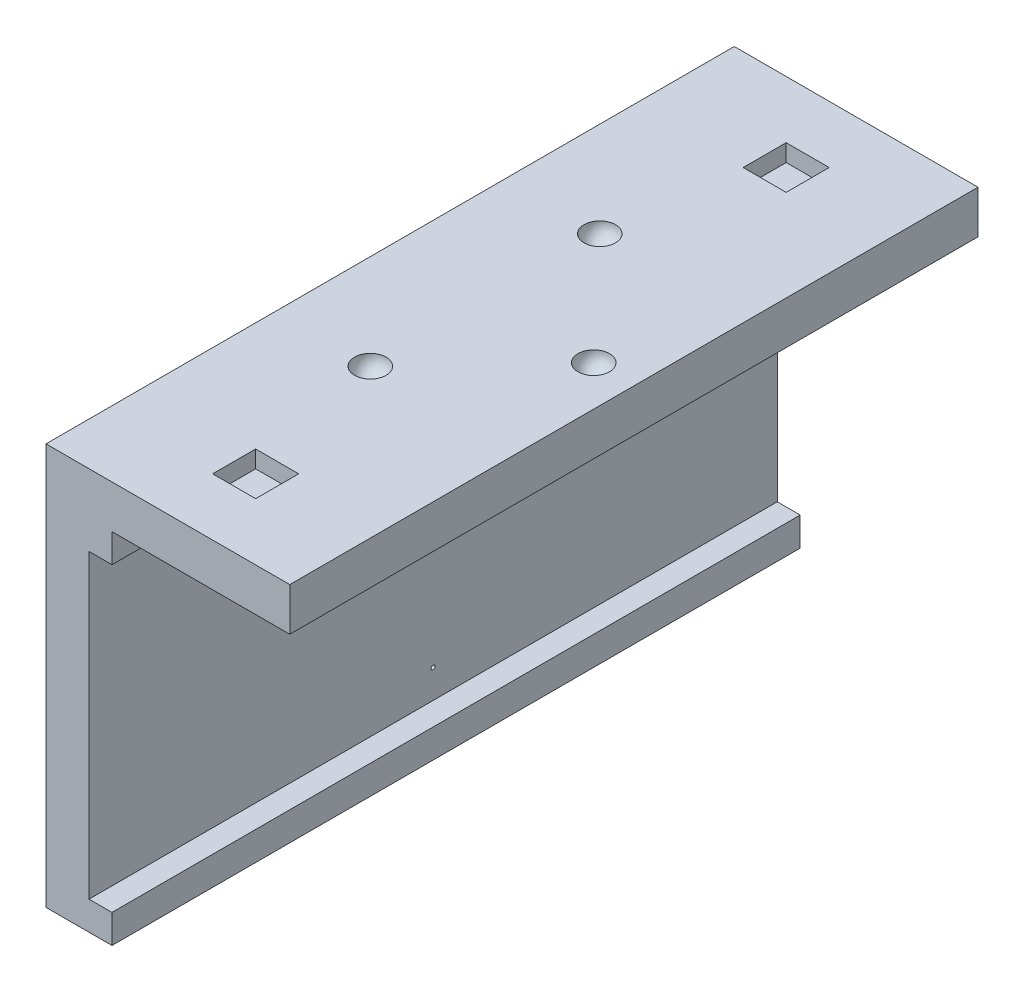
from build123d import *

# Parameters (mm, degrees)
BOSS_EXTRUDE1_DEPTH = 120
SKETCH5_W           = 120
SKETCH5_H           = 5
BOSS_EXTRUDE2_DEPTH = 4
SKETCH7_W           = 7.5
SKETCH7_H           = 7.5
CUT_EXTRUDE3_DEPTH  = 3
SKETCH3_R           = 0.35
CUT_EXTRUDE4_DEPTH  = 146.279902258
SKETCH12_R          = 2.5
BOSS_EXTRUDE3_DEPTH = 4
THREAD1_PITCH       = 0.3175


with BuildPart() as part:
    # Sketch1 → Boss-Extrude1 (new body)
    with BuildSketch(Plane.XY):
        Polygon((0, 0), (0, -70), (7.5, -70), (7.5, -7.5), (42.5, -7.5), (42.5, 0), align=None)
    extrude(amount=BOSS_EXTRUDE1_DEPTH)

    # Sketch5 → Boss-Extrude2 (add)
    with BuildSketch(Plane(origin=(7.5, 0, 0), x_dir=(0, 0, -1), z_dir=(1, 0, 0))):
        with Locations((-60, -67.5)):
            Rectangle(SKETCH5_W, SKETCH5_H)
        with Locations((-60, -10)):
            Rectangle(SKETCH5_W, SKETCH5_H)
    extrude(amount=BOSS_EXTRUDE2_DEPTH)

    # Sketch7 → Cut-Extrude3 (cut)
    with BuildSketch(Plane(origin=(0, 0, 0), x_dir=(1, 0, 0), z_dir=(0, 1, 0))):
        with Locations((22.803920315, -106.25)):
            Rectangle(SKETCH7_W, SKETCH7_H)
    cut_extrude3 = extrude(amount=-CUT_EXTRUDE3_DEPTH, mode=Mode.SUBTRACT)

    # Sketch10 → Cut-Revolve6 (revolve, cut)
    with BuildSketch(Plane(origin=(0, 0, 0), x_dir=(1, 0, 0), z_dir=(0, 1, 0))):
        with BuildLine():
            Line((38.25, -60), (32.75, -60))
            ThreePointArc((32.75, -60), (35.5, -62.75), (38.25, -60))
        make_face()
    revolve(axis=Axis((38.25, 0, 60), (-1, 0, 0)), mode=Mode.SUBTRACT)

    # Sketch11 → Cut-Revolve7 (revolve, cut)
    with BuildSketch(Plane(origin=(0, 0, 0), x_dir=(1, 0, 0), z_dir=(0, 1, 0))):
        with BuildLine():
            Line((19.303920315, -40), (13.803920315, -40))
            ThreePointArc((13.803920315, -40), (16.553920315, -42.75), (19.303920315, -40))
        make_face()
    cut_revolve7 = revolve(axis=Axis((19.303920315, 0, 40), (-1, 0, 0)), mode=Mode.SUBTRACT)

    # Mirror3: Cut-Extrude3, Cut-Revolve7 across plane
    add(cut_extrude3.mirror(Plane.XY.offset(60)), mode=Mode.SUBTRACT)
    add(cut_revolve7.mirror(Plane.XY.offset(60)), mode=Mode.SUBTRACT)

    # Sketch3 → Cut-Extrude4 (cut, through all)
    with BuildSketch(Plane.ZY):
        with Locations(Location((60, -60, 0), (0, 0, 270))):
            Circle(SKETCH3_R)
    extrude(amount=-CUT_EXTRUDE4_DEPTH, mode=Mode.SUBTRACT)

    # Sketch12 → Boss-Extrude3 (add)
    with BuildSketch(Plane(origin=(7.5, 0, 0), x_dir=(0, 0, -1), z_dir=(1, 0, 0))):
        with Locations(Location((-60, -35, 0), (0, 0, 270))):
            Circle(SKETCH12_R)
    extrude(amount=BOSS_EXTRUDE3_DEPTH)

    # Thread1: arcs per turn and ends read off the stored shape
    # Thread1: the profile of Thread Profile1 profile screwed along a right-hand helix through 15.748031 turns, 6 arcs to a turn; built about Z, then put on its axis
    thread1_z = Axis((0, 0, 0), (0, 0, 1))
    thread1_corners = [(2.5003, 0, -0.000173205), (2.5003, 0, 0.277985704), (2.328148085, 0, 0.17859375), (2.328148085, 0, 0.09921875)]
    with BuildLine(mode=Mode.PRIVATE) as thread1_profile:
        Line(thread1_corners[0], thread1_corners[1])
        Line(thread1_corners[1], thread1_corners[2])
        Line(thread1_corners[2], thread1_corners[3])
        Line(thread1_corners[3], thread1_corners[0])
    thread1_cap = Face(thread1_profile.wire())
    thread1_turn_angles = [0, 30, 60, 90, 120, 150, 180, 210, 240, 270, 300, 330, 360]
    thread1_turn_weights = [1, 0.8660254037844387, 1, 0.8660254037844387, 1, 0.8660254037844387, 1, 0.8660254037844387, 1, 0.8660254037844387, 1, 0.8660254037844387, 1]
    thread1_turn_rails = [Edge.make_bspline([Vector(p[0], p[1], 0).rotate(thread1_z, thread1_turn_angles[k]) / thread1_turn_weights[k] + Vector(0, 0, p[2] + THREAD1_PITCH * thread1_turn_angles[k] / 360) for k in range(13)], [0, 0, 0, 1, 1, 2, 2, 3, 3, 4, 4, 5, 5, 6, 6, 6], 2, thread1_turn_weights) for p in thread1_corners]
    thread1_turn_sides = [Face.make_surface_from_curves(thread1_turn_rails[p[0]], thread1_turn_rails[p[1]]) for p in [(0, 1), (1, 2), (2, 3), (3, 0)]]
    thread1_last_angles = [5400, 5430, 5460, 5490, 5520, 5550, 5580, 5610, 5640, 5654.645669291, 5669.291338583]
    thread1_last_weights = [1, 0.8660254037844387, 1, 0.8660254037844387, 1, 0.8660254037844387, 1, 0.8660254037844387, 1, 0.9675079437748935, 1]
    thread1_last_rails = [Edge.make_bspline([Vector(p[0], p[1], 0).rotate(thread1_z, thread1_last_angles[k]) / thread1_last_weights[k] + Vector(0, 0, p[2] + THREAD1_PITCH * thread1_last_angles[k] / 360) for k in range(11)], [0, 0, 0, 1, 1, 2, 2, 3, 3, 4, 4, 5, 5, 5], 2, thread1_last_weights) for p in thread1_corners]
    thread1_last_sides = [Face.make_surface_from_curves(thread1_last_rails[p[0]], thread1_last_rails[p[1]]) for p in [(0, 1), (1, 2), (2, 3), (3, 0)]]
    thread1 = Plane(origin=(11.5, -35, 60), x_dir=(0, 0, 1), z_dir=(-1, 0, 0)) * Solid(Shell([*[p.moved(Location((0, 0, THREAD1_PITCH * i))) for i in range(15) for p in thread1_turn_sides], *thread1_last_sides, thread1_cap, thread1_cap.rotate(thread1_z, 5669.291338583).moved(Location((0, 0, THREAD1_PITCH * 5669.291338583 / 360)))]))
    add(thread1, mode=Mode.SUBTRACT)


solid = part.part
